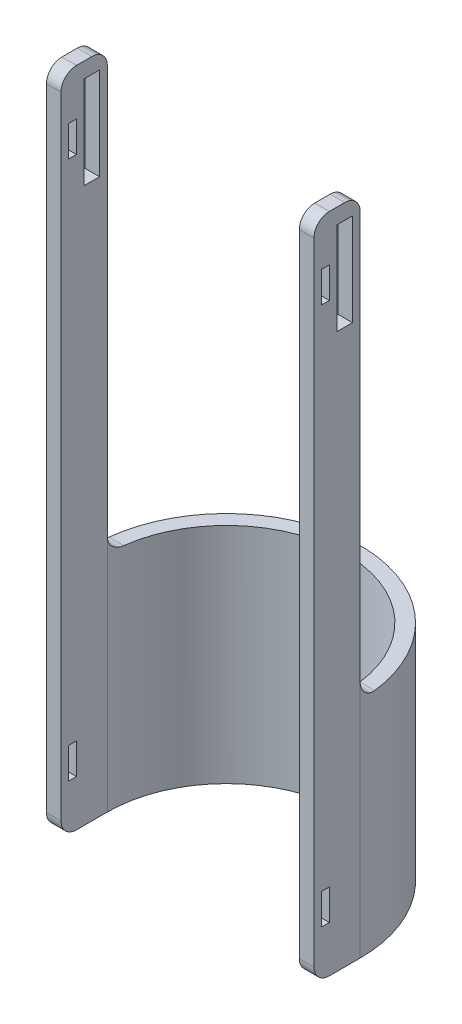
from build123d import *

# Parameters (mm, degrees)
BOSS_EXTRUDE1_DEPTH = 145.01147666
SKETCH2_W           = 9.451272727
SKETCH2_H           = 145.01147666
BOSS_EXTRUDE2_DEPTH = 30
SKETCH3_W           = 9.451272727
SKETCH3_H           = 30
BOSS_EXTRUDE3_DEPTH = 284.3485
SKETCH5_W           = 10
SKETCH5_H           = 60
CUT_EXTRUDE1_DEPTH  = 240
SKETCH6_W           = 5
SKETCH6_H           = 20
CUT_EXTRUDE2_DEPTH  = 472.121269354
FILLET1_R           = 10
FILLET2_R           = 10
FILLET3_R           = 10
SKETCH8_W           = 5
SKETCH8_H           = 20
CUT_EXTRUDE3_DEPTH  = 472.121269409
BOSS_EXTRUDE4_DEPTH = 30.8583
FILLET4_R           = 5
SKETCH10_R          = 1.0922
CUT_EXTRUDE4_DEPTH  = 5


with BuildPart() as part:
    # Sketch1 → Boss-Extrude1 (new body)
    with BuildSketch(Plane(origin=(0, 0, 0), x_dir=(1, 0, 0), z_dir=(0, 1, 0))):
        with BuildLine():
            Line((-77.272727273, 0), (-86.724, 0))
            ThreePointArc((-86.724, 0), (0, 86.724), (86.724, 0))
            Line((86.724, 0), (77.272727273, 0))
            ThreePointArc((77.272727273, 0), (0, 77.272727273), (-77.272727273, 0))
        make_face()
    extrude(amount=BOSS_EXTRUDE1_DEPTH)

    # Sketch2 → Boss-Extrude2 (add)
    with BuildSketch(Plane.XY):
        with Locations((81.998363637, 72.50573833)):
            Rectangle(SKETCH2_W, SKETCH2_H)
        with Locations((-81.998363637, 72.50573833)):
            Rectangle(SKETCH2_W, SKETCH2_H)
    extrude(amount=BOSS_EXTRUDE2_DEPTH)

    # Sketch3 → Boss-Extrude3 (add)
    with BuildSketch(Plane(origin=(0, 145.01147666, 0), x_dir=(1, 0, 0), z_dir=(0, 1, 0))):
        with Locations((-81.998363637, -15)):
            Rectangle(SKETCH3_W, SKETCH3_H)
        with Locations((81.998363637, -15)):
            Rectangle(SKETCH3_W, SKETCH3_H)
    extrude(amount=BOSS_EXTRUDE3_DEPTH)

    # Sketch5 → Cut-Extrude1 (cut)
    with BuildSketch(Plane.ZY.offset(86.724)):
        with Locations((10, 389.35997666)):
            Rectangle(SKETCH5_W, SKETCH5_H)
    extrude(amount=-CUT_EXTRUDE1_DEPTH, mode=Mode.SUBTRACT)

    # Sketch6 → Cut-Extrude2 (cut, through all)
    with BuildSketch(Plane.ZY.offset(86.724)):
        with Locations((22.5, 389.35997666)):
            Rectangle(SKETCH6_W, SKETCH6_H)
    extrude(amount=-CUT_EXTRUDE2_DEPTH, mode=Mode.SUBTRACT)

    # Fillet1
    fillet1_edges = [part.edges().sort_by_distance(p)[0] for p in [
        (-81.998363636, 429.35997666, 0),
        (-81.998363636, 429.35997666, 30),
        (81.998363636, 429.35997666, 0),
        (81.998363636, 429.35997666, 30),
    ]]
    fillet(fillet1_edges, radius=FILLET1_R)

    # Fillet2
    fillet2_edges = [part.edges().sort_by_distance(p)[0] for p in [
        (81.998363636, 0, 30),
        (-81.998363636, 0, 30),
    ]]
    fillet(fillet2_edges, radius=FILLET2_R)

    # Fillet3
    # the kernel refuses this fillet: 10 mm, written as the material it adds along each edge
    with BuildSketch(Plane(origin=(-111.724, 145.01147666, 0), x_dir=(0, 1, 0), z_dir=(1, 0, 0))) as fillet3_piece_1_section:
        with BuildLine():
            CenterArc((FILLET3_R, -FILLET3_R), FILLET3_R, 90, 90)
            Line((0, -FILLET3_R), (0, 0))
            Line((0, 0), (FILLET3_R, 0))
        make_face()
    fillet3_piece_1 = extrude(amount=59.451272727, mode=Mode.PRIVATE)
    fillet3_piece_1 = fillet3_piece_1 & Plane(origin=(0, 147.252284307, 0), x_dir=(-1, 0, 0), z_dir=(0, -1, 0)) * Cylinder(86.724, 159, mode=Mode.PRIVATE)
    fillet3_piece_1 = fillet3_piece_1 - Plane(origin=(0, 147.252284307, 0), x_dir=(1, 0, 0), z_dir=(0, -1, 0)) * Cylinder(77.272727273, 159, mode=Mode.PRIVATE)
    add(fillet3_piece_1)
    with BuildSketch(Plane(origin=(52.272727273, 145.01147666, 0), x_dir=(0, 0, -1), z_dir=(1, 0, 0))) as fillet3_piece_2_section:
        with BuildLine():
            CenterArc((FILLET3_R, FILLET3_R), FILLET3_R, 180, 90)
            Line((0, FILLET3_R), (0, 0))
            Line((0, 0), (FILLET3_R, 0))
        make_face()
    fillet3_piece_2 = extrude(amount=59.451272727, mode=Mode.PRIVATE)
    fillet3_piece_2 = fillet3_piece_2 & Plane(origin=(0, 145.87973925, 0), x_dir=(-1, 0, 0), z_dir=(0, -1, 0)) * Cylinder(86.724, 159, mode=Mode.PRIVATE)
    fillet3_piece_2 = fillet3_piece_2 - Plane(origin=(0, 145.87973925, 0), x_dir=(1, 0, 0), z_dir=(0, -1, 0)) * Cylinder(77.272727273, 159, mode=Mode.PRIVATE)
    add(fillet3_piece_2)

    # Sketch8 → Cut-Extrude3 (cut, through all)
    with BuildSketch(Plane.ZY.offset(86.724)):
        with Locations((22.5, 40)):
            Rectangle(SKETCH8_W, SKETCH8_H)
    extrude(amount=-CUT_EXTRUDE3_DEPTH, mode=Mode.SUBTRACT)

    # Sketch9 → Boss-Extrude4 (add, symmetric)
    with BuildSketch(Plane(origin=(0, 80.01147666, 0), x_dir=(1, 0, 0), z_dir=(0, 1, 0))):
        with BuildLine():
            Line((-26.79918982, 92.479425319), (-26.79918982, 82.479425319))
            ThreePointArc((-26.79918982, 82.479425319), (0, 86.724), (26.79918982, 82.479425319))
            Line((26.79918982, 82.479425319), (26.79918982, 92.479425319))
            Line((26.79918982, 92.479425319), (-26.79918982, 92.479425319))
        make_face()
    extrude(amount=BOSS_EXTRUDE4_DEPTH, both=True)

    # Fillet4
    fillet4_edges = [part.edges().sort_by_distance(p)[0] for p in [
        (0, 110.86977666, -92.479425319),
        (26.79918982, 80.01147666, -92.479425319),
        (-26.79918982, 80.01147666, -92.479425319),
        (0, 49.15317666, -92.479425319),
    ]]
    fillet(fillet4_edges, radius=FILLET4_R)

    # Sketch10 → Cut-Extrude4 (cut)
    with BuildSketch(Plane(origin=(0, 0, -92.479425319), x_dir=(-1, 0, 0), z_dir=(0, 0, -1))):
        with Locations((-16.79918982, 100.86977666)):
            Circle(SKETCH10_R)
        with Locations((16.79918982, 100.86977666)):
            Circle(SKETCH10_R)
        with Locations((-16.79918982, 59.15317666)):
            Circle(SKETCH10_R)
        with Locations((16.79918982, 59.15317666)):
            Circle(SKETCH10_R)
    extrude(amount=-CUT_EXTRUDE4_DEPTH, mode=Mode.SUBTRACT)


solid = part.part
